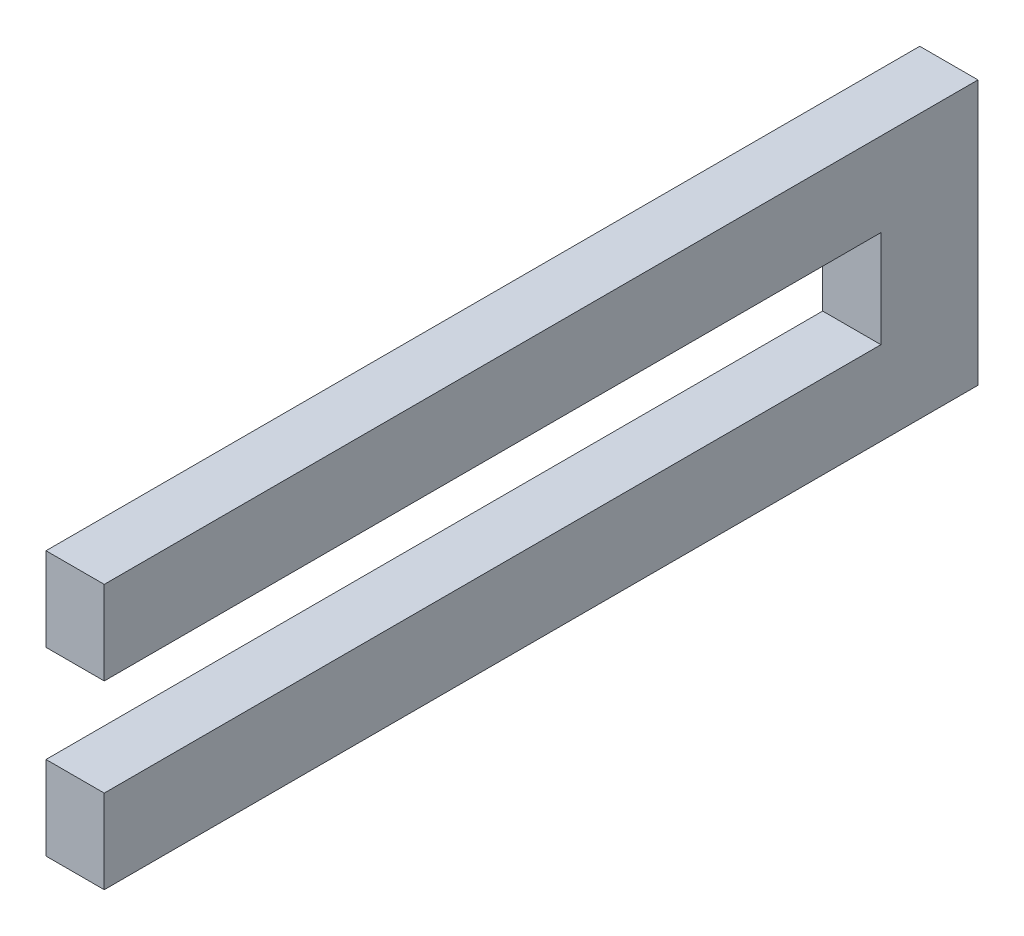
from build123d import *

# Parameters (mm, degrees)
BOSS_EXTRUDE1_DEPTH = 3


with BuildPart() as part:
    # Sketch2 → Boss-Extrude1 (new body)
    with BuildSketch(Plane(origin=(0, 0, 0), x_dir=(0, 0, -1), z_dir=(1, 0, 0))):
        Polygon((-20.452745578, -4.388518255), (24.547254422, -4.388518255), (24.547254422, -18.00920791), (-20.452745578, -18.00920791), (-20.452745578, -13.698863083), (19.547254422, -13.698863083), (19.547254422, -8.698863083), (-20.452745578, -8.698863083), align=None)
    extrude(amount=BOSS_EXTRUDE1_DEPTH)


solid = part.part
